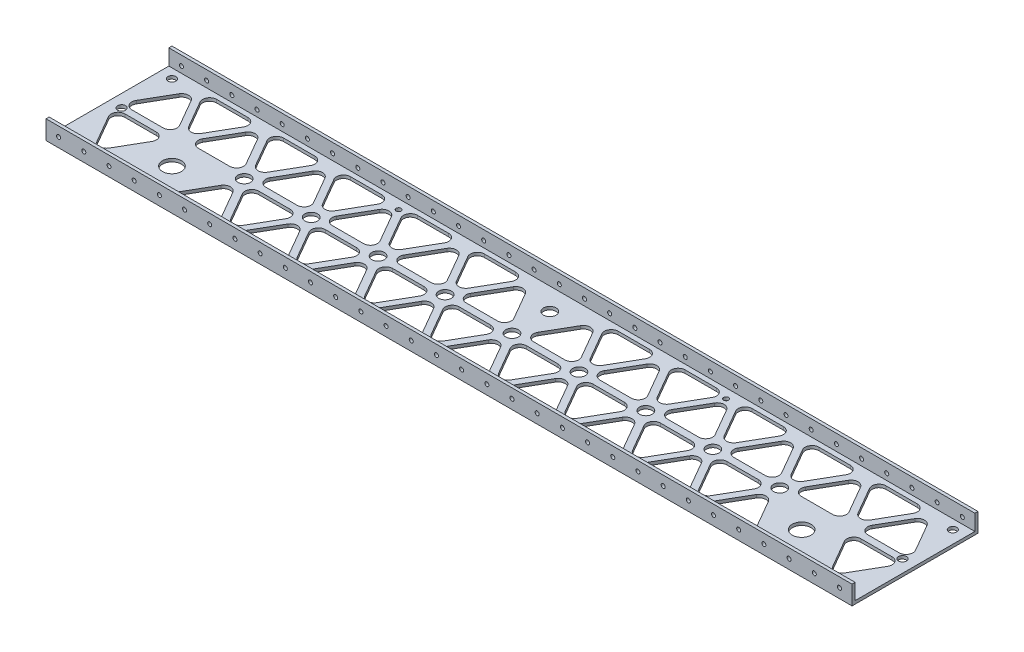
from build123d import *

# Parameters (mm, degrees)
SKETCH1_W                   = 812.8
SKETCH1_H                   = 127
BOSS_EXTRUDE1_DEPTH         = 19.05
SKETCH2_W                   = 120.75
SKETCH2_H                   = 15.925
CUT_EXTRUDE1_DEPTH          = 816.672268745
CUT_EXTRUDE2_DEPTH          = 412.639181353
CUT_EXTRUDE3_DEPTH          = 412.639181353
CUT_EXTRUDE4_DEPTH          = 412.639181353
CUT_EXTRUDE5_DEPTH          = 412.639181353
CUT_EXTRUDE6_DEPTH          = 412.639181353
CUT_EXTRUDE7_DEPTH          = 412.639181353
CUT_EXTRUDE8_DEPTH          = 412.639181353
CUT_EXTRUDE9_DEPTH          = 412.639181353
CUT_EXTRUDE10_DEPTH         = 412.639181353
CUT_EXTRUDE11_DEPTH         = 412.639181353
CUT_EXTRUDE12_DEPTH         = 412.639181353
CUT_EXTRUDE13_DEPTH         = 412.639181353
CUT_EXTRUDE14_DEPTH         = 412.639181353
CUT_EXTRUDE15_DEPTH         = 412.639181353
CUT_EXTRUDE16_DEPTH         = 412.639181353
CUT_EXTRUDE17_DEPTH         = 412.639181353
CUT_EXTRUDE18_DEPTH         = 412.639181353
CUT_EXTRUDE19_DEPTH         = 412.639181353
CUT_EXTRUDE20_DEPTH         = 412.639181353
CUT_EXTRUDE21_DEPTH         = 412.639181353
CUT_EXTRUDE22_DEPTH         = 412.639181353
CUT_EXTRUDE23_DEPTH         = 412.639181353
CUT_EXTRUDE24_DEPTH         = 412.639181353
CUT_EXTRUDE25_DEPTH         = 412.639181353
CUT_EXTRUDE26_DEPTH         = 412.639181353
CUT_EXTRUDE27_DEPTH         = 412.639181353
CUT_EXTRUDE28_DEPTH         = 412.639181353
CUT_EXTRUDE29_DEPTH         = 412.639181353
CUT_EXTRUDE30_DEPTH         = 412.639181353
CUT_EXTRUDE31_DEPTH         = 412.639181353
CUT_EXTRUDE32_DEPTH         = 412.639181353
CUT_EXTRUDE33_DEPTH         = 412.639181353
CUT_EXTRUDE34_DEPTH         = 412.639181353
CUT_EXTRUDE35_DEPTH         = 412.639181353
CUT_EXTRUDE36_DEPTH         = 412.639181353
CUT_EXTRUDE37_DEPTH         = 412.639181353
CUT_EXTRUDE38_DEPTH         = 412.639181353
CUT_EXTRUDE39_DEPTH         = 412.639181353
CUT_EXTRUDE40_DEPTH         = 412.639181353
CUT_EXTRUDE41_DEPTH         = 412.639181353
CUT_EXTRUDE42_DEPTH         = 412.771918057
F_3_4_0_75_DIAMETER_HOLE1_D = 19.05
F_10_CLEARANCE_HOLE1_D      = 5
HOLE1_D                     = 8
F_6_CLEARANCE_HOLE1_D       = 4.064
F_6_CLEARANCE_HOLE1_DEPTH   = 3.125
F_6_CLEARANCE_HOLE2_D       = 4.064
F_6_CLEARANCE_HOLE2_DEPTH   = 127
F_1_2_0_5_DIAMETER_HOLE1_D  = 12.7


with BuildPart() as part:
    # Sketch1 → Boss-Extrude1 (new body)
    with BuildSketch(Plane(origin=(0, -6.35, 0), x_dir=(1, 0, 0), z_dir=(0, 1, 0))):
        Rectangle(SKETCH1_W, SKETCH1_H)
    extrude(amount=-BOSS_EXTRUDE1_DEPTH)

    # Sketch2 → Cut-Extrude1 (cut, through all)
    with BuildSketch(Plane.ZY.offset(406.4)):
        with Locations((0, -14.3125)):
            Rectangle(SKETCH2_W, SKETCH2_H)
    extrude(amount=-CUT_EXTRUDE1_DEPTH, mode=Mode.SUBTRACT)

    # Sketch3 → Cut-Extrude2 (cut, through all)
    with BuildSketch(Plane(origin=(0, -22.275, 0), x_dir=(-1, 0, 0), z_dir=(0, 1, 0))):
        with BuildLine():
            Line((-343.562177826, -17.5), (-359.367141446, -44.875))
            ThreePointArc((-359.367141446, -44.875), (-359.367141446, -51.875), (-353.304963619, -55.375))
            Line((-353.304963619, -55.375), (-321.695036381, -55.375))
            ThreePointArc((-321.695036381, -55.375), (-315.632858554, -51.875), (-315.632858554, -44.875))
            Line((-315.632858554, -44.875), (-331.437822174, -17.5))
            ThreePointArc((-331.437822174, -17.5), (-337.5, -14), (-343.562177826, -17.5))
        make_face()
    extrude(amount=-CUT_EXTRUDE2_DEPTH, mode=Mode.SUBTRACT)

    # Sketch4 → Cut-Extrude3 (cut, through all)
    with BuildSketch(Plane(origin=(0, -22.275, 0), x_dir=(-1, 0, 0), z_dir=(0, 1, 0))):
        with BuildLine():
            Line((-349.141361456, 14), (-364.946325075, 41.375))
            ThreePointArc((-364.946325075, 41.375), (-371.008502901, 44.875), (-377.070680728, 41.375))
            Line((-377.070680728, 41.375), (-392.875644347, 14))
            ThreePointArc((-392.875644347, 14), (-392.875644347, 7), (-386.813466521, 3.5))
            Line((-386.813466521, 3.5), (-355.203539282, 3.5))
            ThreePointArc((-355.203539282, 3.5), (-349.141361456, 7), (-349.141361456, 14))
        make_face()
    extrude(amount=-CUT_EXTRUDE3_DEPTH, mode=Mode.SUBTRACT)

    # Sketch5 → Cut-Extrude4 (cut, through all)
    with BuildSketch(Plane(origin=(0, -22.275, 0), x_dir=(-1, 0, 0), z_dir=(0, 1, 0))):
        with BuildLine():
            Line((-364.946325075, -41.375), (-349.141361456, -14))
            ThreePointArc((-349.141361456, -14), (-349.141361456, -7), (-355.203539282, -3.5))
            Line((-355.203539282, -3.5), (-386.813466521, -3.5))
            ThreePointArc((-386.813466521, -3.5), (-392.875644347, -7), (-392.875644347, -14))
            Line((-392.875644347, -14), (-377.070680728, -41.375))
            ThreePointArc((-377.070680728, -41.375), (-371.008502901, -44.875), (-364.946325075, -41.375))
        make_face()
    extrude(amount=-CUT_EXTRUDE4_DEPTH, mode=Mode.SUBTRACT)

    # Sketch6 → Cut-Extrude5 (cut, through all)
    with BuildSketch(Plane(origin=(0, -22.275, 0), x_dir=(-1, 0, 0), z_dir=(0, 1, 0))):
        with BuildLine():
            Line((364.946325075, 41.375), (349.141361456, 14))
            ThreePointArc((349.141361456, 14), (349.141361456, 7), (355.203539282, 3.5))
            Line((355.203539282, 3.5), (386.813466521, 3.5))
            ThreePointArc((386.813466521, 3.5), (392.875644347, 7), (392.875644347, 14))
            Line((392.875644347, 14), (377.070680728, 41.375))
            ThreePointArc((377.070680728, 41.375), (371.008502901, 44.875), (364.946325075, 41.375))
        make_face()
    extrude(amount=-CUT_EXTRUDE5_DEPTH, mode=Mode.SUBTRACT)

    # Sketch7 → Cut-Extrude6 (cut, through all)
    with BuildSketch(Plane(origin=(0, -22.275, 0), x_dir=(-1, 0, 0), z_dir=(0, 1, 0))):
        with BuildLine():
            Line((349.141361456, -14), (364.946325075, -41.375))
            ThreePointArc((364.946325075, -41.375), (371.008502901, -44.875), (377.070680728, -41.375))
            Line((377.070680728, -41.375), (392.875644347, -14))
            ThreePointArc((392.875644347, -14), (392.875644347, -7), (386.813466521, -3.5))
            Line((386.813466521, -3.5), (355.203539282, -3.5))
            ThreePointArc((355.203539282, -3.5), (349.141361456, -7), (349.141361456, -14))
        make_face()
    extrude(amount=-CUT_EXTRUDE6_DEPTH, mode=Mode.SUBTRACT)

    # Sketch8 → Cut-Extrude7 (cut, through all)
    with BuildSketch(Plane(origin=(0, -22.275, 0), x_dir=(-1, 0, 0), z_dir=(0, 1, 0))):
        with BuildLine():
            Line((331.437822174, -17.5), (315.632858554, -44.875))
            ThreePointArc((315.632858554, -44.875), (315.632858554, -51.875), (321.695036381, -55.375))
            Line((321.695036381, -55.375), (353.304963619, -55.375))
            ThreePointArc((353.304963619, -55.375), (359.367141446, -51.875), (359.367141446, -44.875))
            Line((359.367141446, -44.875), (343.562177826, -17.5))
            ThreePointArc((343.562177826, -17.5), (337.5, -14), (331.437822174, -17.5))
        make_face()
    extrude(amount=-CUT_EXTRUDE7_DEPTH, mode=Mode.SUBTRACT)

    # Sketch9 → Cut-Extrude8 (cut, through all)
    with BuildSketch(Plane(origin=(0, -22.275, 0), x_dir=(-1, 0, 0), z_dir=(0, 1, 0))):
        with BuildLine():
            Line((285.804963619, 55.375), (254.195036381, 55.375))
            ThreePointArc((254.195036381, 55.375), (248.132858554, 51.875), (248.132858554, 44.875))
            Line((248.132858554, 44.875), (263.937822174, 17.5))
            ThreePointArc((263.937822174, 17.5), (270, 14), (276.062177826, 17.5))
            Line((276.062177826, 17.5), (291.867141446, 44.875))
            ThreePointArc((291.867141446, 44.875), (291.867141446, 51.875), (285.804963619, 55.375))
        make_face()
    extrude(amount=-CUT_EXTRUDE8_DEPTH, mode=Mode.SUBTRACT)

    # Sketch10 → Cut-Extrude9 (cut, through all)
    with BuildSketch(Plane(origin=(0, -22.275, 0), x_dir=(-1, 0, 0), z_dir=(0, 1, 0))):
        with BuildLine():
            Line((190.858638544, 14), (175.053674925, 41.375))
            ThreePointArc((175.053674925, 41.375), (168.991497099, 44.875), (162.929319272, 41.375))
            Line((162.929319272, 41.375), (147.124355653, 14))
            ThreePointArc((147.124355653, 14), (147.124355653, 7), (153.186533479, 3.5))
            Line((153.186533479, 3.5), (184.796460718, 3.5))
            ThreePointArc((184.796460718, 3.5), (190.858638544, 7), (190.858638544, 14))
        make_face()
    extrude(amount=-CUT_EXTRUDE9_DEPTH, mode=Mode.SUBTRACT)

    # Sketch11 → Cut-Extrude10 (cut, through all)
    with BuildSketch(Plane(origin=(0, -22.275, 0), x_dir=(-1, 0, 0), z_dir=(0, 1, 0))):
        with BuildLine():
            Line((-276.062177826, -17.5), (-291.867141446, -44.875))
            ThreePointArc((-291.867141446, -44.875), (-291.867141446, -51.875), (-285.804963619, -55.375))
            Line((-285.804963619, -55.375), (-254.195036381, -55.375))
            ThreePointArc((-254.195036381, -55.375), (-248.132858554, -51.875), (-248.132858554, -44.875))
            Line((-248.132858554, -44.875), (-263.937822174, -17.5))
            ThreePointArc((-263.937822174, -17.5), (-270, -14), (-276.062177826, -17.5))
        make_face()
    extrude(amount=-CUT_EXTRUDE10_DEPTH, mode=Mode.SUBTRACT)

    # Sketch12 → Cut-Extrude11 (cut, through all)
    with BuildSketch(Plane(origin=(0, -22.275, 0), x_dir=(-1, 0, 0), z_dir=(0, 1, 0))):
        with BuildLine():
            Line((61.437822174, -17.5), (45.632858554, -44.875))
            ThreePointArc((45.632858554, -44.875), (45.632858554, -51.875), (51.695036381, -55.375))
            Line((51.695036381, -55.375), (83.304963619, -55.375))
            ThreePointArc((83.304963619, -55.375), (89.367141446, -51.875), (89.367141446, -44.875))
            Line((89.367141446, -44.875), (73.562177826, -17.5))
            ThreePointArc((73.562177826, -17.5), (67.5, -14), (61.437822174, -17.5))
        make_face()
    extrude(amount=-CUT_EXTRUDE11_DEPTH, mode=Mode.SUBTRACT)

    # Sketch13 → Cut-Extrude12 (cut, through all)
    with BuildSketch(Plane(origin=(0, -22.275, 0), x_dir=(-1, 0, 0), z_dir=(0, 1, 0))):
        with BuildLine():
            Line((-214.141361456, 14), (-229.946325075, 41.375))
            ThreePointArc((-229.946325075, 41.375), (-236.008502901, 44.875), (-242.070680728, 41.375))
            Line((-242.070680728, 41.375), (-257.875644347, 14))
            ThreePointArc((-257.875644347, 14), (-257.875644347, 7), (-251.813466521, 3.5))
            Line((-251.813466521, 3.5), (-220.203539282, 3.5))
            ThreePointArc((-220.203539282, 3.5), (-214.141361456, 7), (-214.141361456, 14))
        make_face()
    extrude(amount=-CUT_EXTRUDE12_DEPTH, mode=Mode.SUBTRACT)

    # Sketch14 → Cut-Extrude13 (cut, through all)
    with BuildSketch(Plane(origin=(0, -22.275, 0), x_dir=(-1, 0, 0), z_dir=(0, 1, 0))):
        with BuildLine():
            Line((83.304963619, 55.375), (51.695036381, 55.375))
            ThreePointArc((51.695036381, 55.375), (45.632858554, 51.875), (45.632858554, 44.875))
            Line((45.632858554, 44.875), (61.437822174, 17.5))
            ThreePointArc((61.437822174, 17.5), (67.5, 14), (73.562177826, 17.5))
            Line((73.562177826, 17.5), (89.367141446, 44.875))
            ThreePointArc((89.367141446, 44.875), (89.367141446, 51.875), (83.304963619, 55.375))
        make_face()
    extrude(amount=-CUT_EXTRUDE13_DEPTH, mode=Mode.SUBTRACT)

    # Sketch15 → Cut-Extrude14 (cut, through all)
    with BuildSketch(Plane(origin=(0, -22.275, 0), x_dir=(-1, 0, 0), z_dir=(0, 1, 0))):
        with BuildLine():
            Line((-325.858638544, -14), (-310.053674925, -41.375))
            ThreePointArc((-310.053674925, -41.375), (-303.991497099, -44.875), (-297.929319272, -41.375))
            Line((-297.929319272, -41.375), (-282.124355653, -14))
            ThreePointArc((-282.124355653, -14), (-282.124355653, -7), (-288.186533479, -3.5))
            Line((-288.186533479, -3.5), (-319.796460718, -3.5))
            ThreePointArc((-319.796460718, -3.5), (-325.858638544, -7), (-325.858638544, -14))
        make_face()
    extrude(amount=-CUT_EXTRUDE14_DEPTH, mode=Mode.SUBTRACT)

    # Sketch16 → Cut-Extrude15 (cut, through all)
    with BuildSketch(Plane(origin=(0, -22.275, 0), x_dir=(-1, 0, 0), z_dir=(0, 1, 0))):
        with BuildLine():
            Line((263.937822174, -17.5), (248.132858554, -44.875))
            ThreePointArc((248.132858554, -44.875), (248.132858554, -51.875), (254.195036381, -55.375))
            Line((254.195036381, -55.375), (285.804963619, -55.375))
            ThreePointArc((285.804963619, -55.375), (291.867141446, -51.875), (291.867141446, -44.875))
            Line((291.867141446, -44.875), (276.062177826, -17.5))
            ThreePointArc((276.062177826, -17.5), (270, -14), (263.937822174, -17.5))
        make_face()
    extrude(amount=-CUT_EXTRUDE15_DEPTH, mode=Mode.SUBTRACT)

    # Sketch17 → Cut-Extrude16 (cut, through all)
    with BuildSketch(Plane(origin=(0, -22.275, 0), x_dir=(-1, 0, 0), z_dir=(0, 1, 0))):
        with BuildLine():
            Line((-254.195036381, 55.375), (-285.804963619, 55.375))
            ThreePointArc((-285.804963619, 55.375), (-291.867141446, 51.875), (-291.867141446, 44.875))
            Line((-291.867141446, 44.875), (-276.062177826, 17.5))
            ThreePointArc((-276.062177826, 17.5), (-270, 14), (-263.937822174, 17.5))
            Line((-263.937822174, 17.5), (-248.132858554, 44.875))
            ThreePointArc((-248.132858554, 44.875), (-248.132858554, 51.875), (-254.195036381, 55.375))
        make_face()
    extrude(amount=-CUT_EXTRUDE16_DEPTH, mode=Mode.SUBTRACT)

    # Sketch18 → Cut-Extrude17 (cut, through all)
    with BuildSketch(Plane(origin=(0, -22.275, 0), x_dir=(-1, 0, 0), z_dir=(0, 1, 0))):
        with BuildLine():
            Line((-51.695036381, 55.375), (-83.304963619, 55.375))
            ThreePointArc((-83.304963619, 55.375), (-89.367141446, 51.875), (-89.367141446, 44.875))
            Line((-89.367141446, 44.875), (-73.562177826, 17.5))
            ThreePointArc((-73.562177826, 17.5), (-67.5, 14), (-61.437822174, 17.5))
            Line((-61.437822174, 17.5), (-45.632858554, 44.875))
            ThreePointArc((-45.632858554, 44.875), (-45.632858554, 51.875), (-51.695036381, 55.375))
        make_face()
    extrude(amount=-CUT_EXTRUDE17_DEPTH, mode=Mode.SUBTRACT)

    # Sketch19 → Cut-Extrude18 (cut, through all)
    with BuildSketch(Plane(origin=(0, -22.275, 0), x_dir=(-1, 0, 0), z_dir=(0, 1, 0))):
        with BuildLine():
            Line((-190.858638544, -14), (-175.053674925, -41.375))
            ThreePointArc((-175.053674925, -41.375), (-168.991497099, -44.875), (-162.929319272, -41.375))
            Line((-162.929319272, -41.375), (-147.124355653, -14))
            ThreePointArc((-147.124355653, -14), (-147.124355653, -7), (-153.186533479, -3.5))
            Line((-153.186533479, -3.5), (-184.796460718, -3.5))
            ThreePointArc((-184.796460718, -3.5), (-190.858638544, -7), (-190.858638544, -14))
        make_face()
    extrude(amount=-CUT_EXTRUDE18_DEPTH, mode=Mode.SUBTRACT)

    # Sketch20 → Cut-Extrude19 (cut, through all)
    with BuildSketch(Plane(origin=(0, -22.275, 0), x_dir=(-1, 0, 0), z_dir=(0, 1, 0))):
        with BuildLine():
            Line((175.053674925, -41.375), (190.858638544, -14))
            ThreePointArc((190.858638544, -14), (190.858638544, -7), (184.796460718, -3.5))
            Line((184.796460718, -3.5), (153.186533479, -3.5))
            ThreePointArc((153.186533479, -3.5), (147.124355653, -7), (147.124355653, -14))
            Line((147.124355653, -14), (162.929319272, -41.375))
            ThreePointArc((162.929319272, -41.375), (168.991497099, -44.875), (175.053674925, -41.375))
        make_face()
    extrude(amount=-CUT_EXTRUDE19_DEPTH, mode=Mode.SUBTRACT)

    # Sketch21 → Cut-Extrude20 (cut, through all)
    with BuildSketch(Plane(origin=(0, -22.275, 0), x_dir=(-1, 0, 0), z_dir=(0, 1, 0))):
        with BuildLine():
            Line((218.304963619, 55.375), (186.695036381, 55.375))
            ThreePointArc((186.695036381, 55.375), (180.632858554, 51.875), (180.632858554, 44.875))
            Line((180.632858554, 44.875), (196.437822174, 17.5))
            ThreePointArc((196.437822174, 17.5), (202.5, 14), (208.562177826, 17.5))
            Line((208.562177826, 17.5), (224.367141446, 44.875))
            ThreePointArc((224.367141446, 44.875), (224.367141446, 51.875), (218.304963619, 55.375))
        make_face()
    extrude(amount=-CUT_EXTRUDE20_DEPTH, mode=Mode.SUBTRACT)

    # Sketch22 → Cut-Extrude21 (cut, through all)
    with BuildSketch(Plane(origin=(0, -22.275, 0), x_dir=(-1, 0, 0), z_dir=(0, 1, 0))):
        with BuildLine():
            Line((-55.858638544, -14), (-40.053674925, -41.375))
            ThreePointArc((-40.053674925, -41.375), (-33.991497099, -44.875), (-27.929319272, -41.375))
            Line((-27.929319272, -41.375), (-12.124355653, -14))
            ThreePointArc((-12.124355653, -14), (-12.124355653, -7), (-18.186533479, -3.5))
            Line((-18.186533479, -3.5), (-49.796460718, -3.5))
            ThreePointArc((-49.796460718, -3.5), (-55.858638544, -7), (-55.858638544, -14))
        make_face()
    extrude(amount=-CUT_EXTRUDE21_DEPTH, mode=Mode.SUBTRACT)

    # Sketch23 → Cut-Extrude22 (cut, through all)
    with BuildSketch(Plane(origin=(0, -22.275, 0), x_dir=(-1, 0, 0), z_dir=(0, 1, 0))):
        with BuildLine():
            Line((-73.562177826, -17.5), (-89.367141446, -44.875))
            ThreePointArc((-89.367141446, -44.875), (-89.367141446, -51.875), (-83.304963619, -55.375))
            Line((-83.304963619, -55.375), (-51.695036381, -55.375))
            ThreePointArc((-51.695036381, -55.375), (-45.632858554, -51.875), (-45.632858554, -44.875))
            Line((-45.632858554, -44.875), (-61.437822174, -17.5))
            ThreePointArc((-61.437822174, -17.5), (-67.5, -14), (-73.562177826, -17.5))
        make_face()
    extrude(amount=-CUT_EXTRUDE22_DEPTH, mode=Mode.SUBTRACT)

    # Sketch24 → Cut-Extrude23 (cut, through all)
    with BuildSketch(Plane(origin=(0, -22.275, 0), x_dir=(-1, 0, 0), z_dir=(0, 1, 0))):
        with BuildLine():
            Line((310.053674925, -41.375), (325.858638544, -14))
            ThreePointArc((325.858638544, -14), (325.858638544, -7), (319.796460718, -3.5))
            Line((319.796460718, -3.5), (288.186533479, -3.5))
            ThreePointArc((288.186533479, -3.5), (282.124355653, -7), (282.124355653, -14))
            Line((282.124355653, -14), (297.929319272, -41.375))
            ThreePointArc((297.929319272, -41.375), (303.991497099, -44.875), (310.053674925, -41.375))
        make_face()
    extrude(amount=-CUT_EXTRUDE23_DEPTH, mode=Mode.SUBTRACT)

    # Sketch25 → Cut-Extrude24 (cut, through all)
    with BuildSketch(Plane(origin=(0, -22.275, 0), x_dir=(-1, 0, 0), z_dir=(0, 1, 0))):
        with BuildLine():
            Line((-40.053674925, 41.375), (-55.858638544, 14))
            ThreePointArc((-55.858638544, 14), (-55.858638544, 7), (-49.796460718, 3.5))
            Line((-49.796460718, 3.5), (-18.186533479, 3.5))
            ThreePointArc((-18.186533479, 3.5), (-12.124355653, 7), (-12.124355653, 14))
            Line((-12.124355653, 14), (-27.929319272, 41.375))
            ThreePointArc((-27.929319272, 41.375), (-33.991497099, 44.875), (-40.053674925, 41.375))
        make_face()
    extrude(amount=-CUT_EXTRUDE24_DEPTH, mode=Mode.SUBTRACT)

    # Sketch26 → Cut-Extrude25 (cut, through all)
    with BuildSketch(Plane(origin=(0, -22.275, 0), x_dir=(-1, 0, 0), z_dir=(0, 1, 0))):
        with BuildLine():
            Line((214.141361456, -14), (229.946325075, -41.375))
            ThreePointArc((229.946325075, -41.375), (236.008502901, -44.875), (242.070680728, -41.375))
            Line((242.070680728, -41.375), (257.875644347, -14))
            ThreePointArc((257.875644347, -14), (257.875644347, -7), (251.813466521, -3.5))
            Line((251.813466521, -3.5), (220.203539282, -3.5))
            ThreePointArc((220.203539282, -3.5), (214.141361456, -7), (214.141361456, -14))
        make_face()
    extrude(amount=-CUT_EXTRUDE25_DEPTH, mode=Mode.SUBTRACT)

    # Sketch27 → Cut-Extrude26 (cut, through all)
    with BuildSketch(Plane(origin=(0, -22.275, 0), x_dir=(-1, 0, 0), z_dir=(0, 1, 0))):
        with BuildLine():
            Line((128.937822174, -17.5), (113.132858554, -44.875))
            ThreePointArc((113.132858554, -44.875), (113.132858554, -51.875), (119.195036381, -55.375))
            Line((119.195036381, -55.375), (150.804963619, -55.375))
            ThreePointArc((150.804963619, -55.375), (156.867141446, -51.875), (156.867141446, -44.875))
            Line((156.867141446, -44.875), (141.062177826, -17.5))
            ThreePointArc((141.062177826, -17.5), (135, -14), (128.937822174, -17.5))
        make_face()
    extrude(amount=-CUT_EXTRUDE26_DEPTH, mode=Mode.SUBTRACT)

    # Sketch28 → Cut-Extrude27 (cut, through all)
    with BuildSketch(Plane(origin=(0, -22.275, 0), x_dir=(-1, 0, 0), z_dir=(0, 1, 0))):
        with BuildLine():
            Line((229.946325075, 41.375), (214.141361456, 14))
            ThreePointArc((214.141361456, 14), (214.141361456, 7), (220.203539282, 3.5))
            Line((220.203539282, 3.5), (251.813466521, 3.5))
            ThreePointArc((251.813466521, 3.5), (257.875644347, 7), (257.875644347, 14))
            Line((257.875644347, 14), (242.070680728, 41.375))
            ThreePointArc((242.070680728, 41.375), (236.008502901, 44.875), (229.946325075, 41.375))
        make_face()
    extrude(amount=-CUT_EXTRUDE27_DEPTH, mode=Mode.SUBTRACT)

    # Sketch29 → Cut-Extrude28 (cut, through all)
    with BuildSketch(Plane(origin=(0, -22.275, 0), x_dir=(-1, 0, 0), z_dir=(0, 1, 0))):
        with BuildLine():
            Line((-229.946325075, -41.375), (-214.141361456, -14))
            ThreePointArc((-214.141361456, -14), (-214.141361456, -7), (-220.203539282, -3.5))
            Line((-220.203539282, -3.5), (-251.813466521, -3.5))
            ThreePointArc((-251.813466521, -3.5), (-257.875644347, -7), (-257.875644347, -14))
            Line((-257.875644347, -14), (-242.070680728, -41.375))
            ThreePointArc((-242.070680728, -41.375), (-236.008502901, -44.875), (-229.946325075, -41.375))
        make_face()
    extrude(amount=-CUT_EXTRUDE28_DEPTH, mode=Mode.SUBTRACT)

    # Sketch30 → Cut-Extrude29 (cut, through all)
    with BuildSketch(Plane(origin=(0, -22.275, 0), x_dir=(-1, 0, 0), z_dir=(0, 1, 0))):
        with BuildLine():
            Line((150.804963619, 55.375), (119.195036381, 55.375))
            ThreePointArc((119.195036381, 55.375), (113.132858554, 51.875), (113.132858554, 44.875))
            Line((113.132858554, 44.875), (128.937822174, 17.5))
            ThreePointArc((128.937822174, 17.5), (135, 14), (141.062177826, 17.5))
            Line((141.062177826, 17.5), (156.867141446, 44.875))
            ThreePointArc((156.867141446, 44.875), (156.867141446, 51.875), (150.804963619, 55.375))
        make_face()
    extrude(amount=-CUT_EXTRUDE29_DEPTH, mode=Mode.SUBTRACT)

    # Sketch31 → Cut-Extrude30 (cut, through all)
    with BuildSketch(Plane(origin=(0, -22.275, 0), x_dir=(-1, 0, 0), z_dir=(0, 1, 0))):
        with BuildLine():
            Line((15.804963619, 55.375), (-15.804963619, 55.375))
            ThreePointArc((-15.804963619, 55.375), (-21.867141446, 51.875), (-21.867141446, 44.875))
            Line((-21.867141446, 44.875), (-6.062177826, 17.5))
            ThreePointArc((-6.062177826, 17.5), (0, 14), (6.062177826, 17.5))
            Line((6.062177826, 17.5), (21.867141446, 44.875))
            ThreePointArc((21.867141446, 44.875), (21.867141446, 51.875), (15.804963619, 55.375))
        make_face()
    extrude(amount=-CUT_EXTRUDE30_DEPTH, mode=Mode.SUBTRACT)

    # Sketch32 → Cut-Extrude31 (cut, through all)
    with BuildSketch(Plane(origin=(0, -22.275, 0), x_dir=(-1, 0, 0), z_dir=(0, 1, 0))):
        with BuildLine():
            Line((94.946325075, 41.375), (79.141361456, 14))
            ThreePointArc((79.141361456, 14), (79.141361456, 7), (85.203539282, 3.5))
            Line((85.203539282, 3.5), (116.813466521, 3.5))
            ThreePointArc((116.813466521, 3.5), (122.875644347, 7), (122.875644347, 14))
            Line((122.875644347, 14), (107.070680728, 41.375))
            ThreePointArc((107.070680728, 41.375), (101.008502901, 44.875), (94.946325075, 41.375))
        make_face()
    extrude(amount=-CUT_EXTRUDE31_DEPTH, mode=Mode.SUBTRACT)

    # Sketch33 → Cut-Extrude32 (cut, through all)
    with BuildSketch(Plane(origin=(0, -22.275, 0), x_dir=(-1, 0, 0), z_dir=(0, 1, 0))):
        with BuildLine():
            Line((55.858638544, 14), (40.053674925, 41.375))
            ThreePointArc((40.053674925, 41.375), (33.991497099, 44.875), (27.929319272, 41.375))
            Line((27.929319272, 41.375), (12.124355653, 14))
            ThreePointArc((12.124355653, 14), (12.124355653, 7), (18.186533479, 3.5))
            Line((18.186533479, 3.5), (49.796460718, 3.5))
            ThreePointArc((49.796460718, 3.5), (55.858638544, 7), (55.858638544, 14))
        make_face()
    extrude(amount=-CUT_EXTRUDE32_DEPTH, mode=Mode.SUBTRACT)

    # Sketch34 → Cut-Extrude33 (cut, through all)
    with BuildSketch(Plane(origin=(0, -22.275, 0), x_dir=(-1, 0, 0), z_dir=(0, 1, 0))):
        with BuildLine():
            Line((79.141361456, -14), (94.946325075, -41.375))
            ThreePointArc((94.946325075, -41.375), (101.008502901, -44.875), (107.070680728, -41.375))
            Line((107.070680728, -41.375), (122.875644347, -14))
            ThreePointArc((122.875644347, -14), (122.875644347, -7), (116.813466521, -3.5))
            Line((116.813466521, -3.5), (85.203539282, -3.5))
            ThreePointArc((85.203539282, -3.5), (79.141361456, -7), (79.141361456, -14))
        make_face()
    extrude(amount=-CUT_EXTRUDE33_DEPTH, mode=Mode.SUBTRACT)

    # Sketch35 → Cut-Extrude34 (cut, through all)
    with BuildSketch(Plane(origin=(0, -22.275, 0), x_dir=(-1, 0, 0), z_dir=(0, 1, 0))):
        with BuildLine():
            Line((40.053674925, -41.375), (55.858638544, -14))
            ThreePointArc((55.858638544, -14), (55.858638544, -7), (49.796460718, -3.5))
            Line((49.796460718, -3.5), (18.186533479, -3.5))
            ThreePointArc((18.186533479, -3.5), (12.124355653, -7), (12.124355653, -14))
            Line((12.124355653, -14), (27.929319272, -41.375))
            ThreePointArc((27.929319272, -41.375), (33.991497099, -44.875), (40.053674925, -41.375))
        make_face()
    extrude(amount=-CUT_EXTRUDE34_DEPTH, mode=Mode.SUBTRACT)

    # Sketch36 → Cut-Extrude35 (cut, through all)
    with BuildSketch(Plane(origin=(0, -22.275, 0), x_dir=(-1, 0, 0), z_dir=(0, 1, 0))):
        with BuildLine():
            Line((-94.946325075, -41.375), (-79.141361456, -14))
            ThreePointArc((-79.141361456, -14), (-79.141361456, -7), (-85.203539282, -3.5))
            Line((-85.203539282, -3.5), (-116.813466521, -3.5))
            ThreePointArc((-116.813466521, -3.5), (-122.875644347, -7), (-122.875644347, -14))
            Line((-122.875644347, -14), (-107.070680728, -41.375))
            ThreePointArc((-107.070680728, -41.375), (-101.008502901, -44.875), (-94.946325075, -41.375))
        make_face()
    extrude(amount=-CUT_EXTRUDE35_DEPTH, mode=Mode.SUBTRACT)

    # Sketch37 → Cut-Extrude36 (cut, through all)
    with BuildSketch(Plane(origin=(0, -22.275, 0), x_dir=(-1, 0, 0), z_dir=(0, 1, 0))):
        with BuildLine():
            Line((-119.195036381, 55.375), (-150.804963619, 55.375))
            ThreePointArc((-150.804963619, 55.375), (-156.867141446, 51.875), (-156.867141446, 44.875))
            Line((-156.867141446, 44.875), (-141.062177826, 17.5))
            ThreePointArc((-141.062177826, 17.5), (-135, 14), (-128.937822174, 17.5))
            Line((-128.937822174, 17.5), (-113.132858554, 44.875))
            ThreePointArc((-113.132858554, 44.875), (-113.132858554, 51.875), (-119.195036381, 55.375))
        make_face()
    extrude(amount=-CUT_EXTRUDE36_DEPTH, mode=Mode.SUBTRACT)

    # Sketch38 → Cut-Extrude37 (cut, through all)
    with BuildSketch(Plane(origin=(0, -22.275, 0), x_dir=(-1, 0, 0), z_dir=(0, 1, 0))):
        with BuildLine():
            Line((-175.053674925, 41.375), (-190.858638544, 14))
            ThreePointArc((-190.858638544, 14), (-190.858638544, 7), (-184.796460718, 3.5))
            Line((-184.796460718, 3.5), (-153.186533479, 3.5))
            ThreePointArc((-153.186533479, 3.5), (-147.124355653, 7), (-147.124355653, 14))
            Line((-147.124355653, 14), (-162.929319272, 41.375))
            ThreePointArc((-162.929319272, 41.375), (-168.991497099, 44.875), (-175.053674925, 41.375))
        make_face()
    extrude(amount=-CUT_EXTRUDE37_DEPTH, mode=Mode.SUBTRACT)

    # Sketch39 → Cut-Extrude38 (cut, through all)
    with BuildSketch(Plane(origin=(0, -22.275, 0), x_dir=(-1, 0, 0), z_dir=(0, 1, 0))):
        with BuildLine():
            Line((-208.562177826, -17.5), (-224.367141446, -44.875))
            ThreePointArc((-224.367141446, -44.875), (-224.367141446, -51.875), (-218.304963619, -55.375))
            Line((-218.304963619, -55.375), (-186.695036381, -55.375))
            ThreePointArc((-186.695036381, -55.375), (-180.632858554, -51.875), (-180.632858554, -44.875))
            Line((-180.632858554, -44.875), (-196.437822174, -17.5))
            ThreePointArc((-196.437822174, -17.5), (-202.5, -14), (-208.562177826, -17.5))
        make_face()
    extrude(amount=-CUT_EXTRUDE38_DEPTH, mode=Mode.SUBTRACT)

    # Sketch40 → Cut-Extrude39 (cut, through all)
    with BuildSketch(Plane(origin=(0, -22.275, 0), x_dir=(-1, 0, 0), z_dir=(0, 1, 0))):
        with BuildLine():
            Line((-79.141361456, 14), (-94.946325075, 41.375))
            ThreePointArc((-94.946325075, 41.375), (-101.008502901, 44.875), (-107.070680728, 41.375))
            Line((-107.070680728, 41.375), (-122.875644347, 14))
            ThreePointArc((-122.875644347, 14), (-122.875644347, 7), (-116.813466521, 3.5))
            Line((-116.813466521, 3.5), (-85.203539282, 3.5))
            ThreePointArc((-85.203539282, 3.5), (-79.141361456, 7), (-79.141361456, 14))
        make_face()
    extrude(amount=-CUT_EXTRUDE39_DEPTH, mode=Mode.SUBTRACT)

    # Sketch41 → Cut-Extrude40 (cut, through all)
    with BuildSketch(Plane(origin=(0, -22.275, 0), x_dir=(-1, 0, 0), z_dir=(0, 1, 0))):
        with BuildLine():
            Line((-186.695036381, 55.375), (-218.304963619, 55.375))
            ThreePointArc((-218.304963619, 55.375), (-224.367141446, 51.875), (-224.367141446, 44.875))
            Line((-224.367141446, 44.875), (-208.562177826, 17.5))
            ThreePointArc((-208.562177826, 17.5), (-202.5, 14), (-196.437822174, 17.5))
            Line((-196.437822174, 17.5), (-180.632858554, 44.875))
            ThreePointArc((-180.632858554, 44.875), (-180.632858554, 51.875), (-186.695036381, 55.375))
        make_face()
    extrude(amount=-CUT_EXTRUDE40_DEPTH, mode=Mode.SUBTRACT)

    # Sketch42 → Cut-Extrude41 (cut, through all)
    with BuildSketch(Plane(origin=(0, -22.275, 0), x_dir=(-1, 0, 0), z_dir=(0, 1, 0))):
        with BuildLine():
            Line((196.437822174, -17.5), (180.632858554, -44.875))
            ThreePointArc((180.632858554, -44.875), (180.632858554, -51.875), (186.695036381, -55.375))
            Line((186.695036381, -55.375), (218.304963619, -55.375))
            ThreePointArc((218.304963619, -55.375), (224.367141446, -51.875), (224.367141446, -44.875))
            Line((224.367141446, -44.875), (208.562177826, -17.5))
            ThreePointArc((208.562177826, -17.5), (202.5, -14), (196.437822174, -17.5))
        make_face()
    extrude(amount=-CUT_EXTRUDE41_DEPTH, mode=Mode.SUBTRACT)

    # Sketch43 → Cut-Extrude42 (cut, through all)
    with BuildSketch(Plane.XZ.offset(25.4)):
        with BuildLine():
            Line((128.937822174, -17.5), (113.132858554, -44.875))
            ThreePointArc((113.132858554, -44.875), (113.132858554, -51.875), (119.195036381, -55.375))
            Line((119.195036381, -55.375), (150.804963619, -55.375))
            ThreePointArc((150.804963619, -55.375), (156.867141446, -51.875), (156.867141446, -44.875))
            Line((156.867141446, -44.875), (141.062177826, -17.5))
            ThreePointArc((141.062177826, -17.5), (135, -14), (128.937822174, -17.5))
        make_face()
    extrude(amount=-CUT_EXTRUDE42_DEPTH, mode=Mode.SUBTRACT)

    # 3/4 (0.75) Diameter Hole1 (through all)
    with Locations(Plane(origin=(0, -22.275, 0), x_dir=(1, 0, 0), z_dir=(0, 1, 0))):
        with Locations((317.5, -25.4), (-317.5, -25.4)):
            Hole(F_3_4_0_75_DIAMETER_HOLE1_D / 2)

    # #10 Clearance Hole1 (through all)
    with Locations(Plane(origin=(0, -22.275, 0), x_dir=(1, 0, 0), z_dir=(0, 1, 0))):
        with Locations((165.1, 50.8), (165.1, -50.8), (-165.1, 50.8), (-165.1, -50.8)):
            Hole(F_10_CLEARANCE_HOLE1_D / 2)

    # Hole1 (through all)
    with Locations(Plane(origin=(0, -22.275, 0), x_dir=(1, 0, 0), z_dir=(0, 1, 0))):
        with Locations((393.7, 50.8), (393.7, 0), (-393.7, 50.8), (-393.7, 0)):
            Hole(HOLE1_D / 2)

    # #6 Clearance Hole1
    with Locations(Plane(origin=(0, 0, 60.375), x_dir=(-1, 0, 0), z_dir=(0, 0, -1))):
        with Locations((-393.7, -15.875), (-368.3, -15.875), (-342.9, -15.875), (-317.5, -15.875), (-292.1, -15.875), (-266.7, -15.875), (-241.3, -15.875), (-215.9, -15.875), (-190.5, -15.875), (-165.1, -15.875), (-139.7, -15.875), (-114.3, -15.875), (-88.9, -15.875), (-63.5, -15.875), (-38.1, -15.875), (-12.7, -15.875), (12.7, -15.875), (38.1, -15.875), (63.5, -15.875), (88.9, -15.875), (114.3, -15.875), (139.7, -15.875), (165.1, -15.875), (190.5, -15.875), (215.9, -15.875), (241.3, -15.875), (266.7, -15.875), (292.1, -15.875), (317.5, -15.875), (342.9, -15.875), (368.3, -15.875), (393.7, -15.875)):
            Hole(F_6_CLEARANCE_HOLE1_D / 2, depth=F_6_CLEARANCE_HOLE1_DEPTH)

    # #6 Clearance Hole2
    with Locations(Plane(origin=(0, 0, -63.5), x_dir=(-1, 0, 0), z_dir=(0, 0, -1))):
        with Locations((-393.7, -15.875), (-368.3, -15.875), (-342.9, -15.875), (-317.5, -15.875), (-292.1, -15.875), (-266.7, -15.875), (-241.3, -15.875), (-215.9, -15.875), (-190.5, -15.875), (-165.1, -15.875), (-139.7, -15.875), (-114.3, -15.875), (-88.9, -15.875), (-63.5, -15.875), (-38.1, -15.875), (-12.7, -15.875), (12.7, -15.875), (38.1, -15.875), (63.5, -15.875), (88.9, -15.875), (114.3, -15.875), (139.7, -15.875), (165.1, -15.875), (190.5, -15.875), (215.9, -15.875), (241.3, -15.875), (266.7, -15.875), (292.1, -15.875), (317.5, -15.875), (342.9, -15.875), (368.3, -15.875), (393.7, -15.875)):
            Hole(F_6_CLEARANCE_HOLE2_D / 2, depth=F_6_CLEARANCE_HOLE2_DEPTH)

    # 1/2 (0.5) Diameter Hole1 (through all)
    with Locations(Plane(origin=(0, -22.275, 0), x_dir=(1, 0, 0), z_dir=(0, 1, 0))):
        with Locations((270, 0), (202.5, 0), (135, 0), (67.5, 0), (-67.5, 0), (-135, 0), (-202.5, 0), (-270, 0), (0, 0), (0, 38.1)):
            Hole(F_1_2_0_5_DIAMETER_HOLE1_D / 2)


solid = part.part
